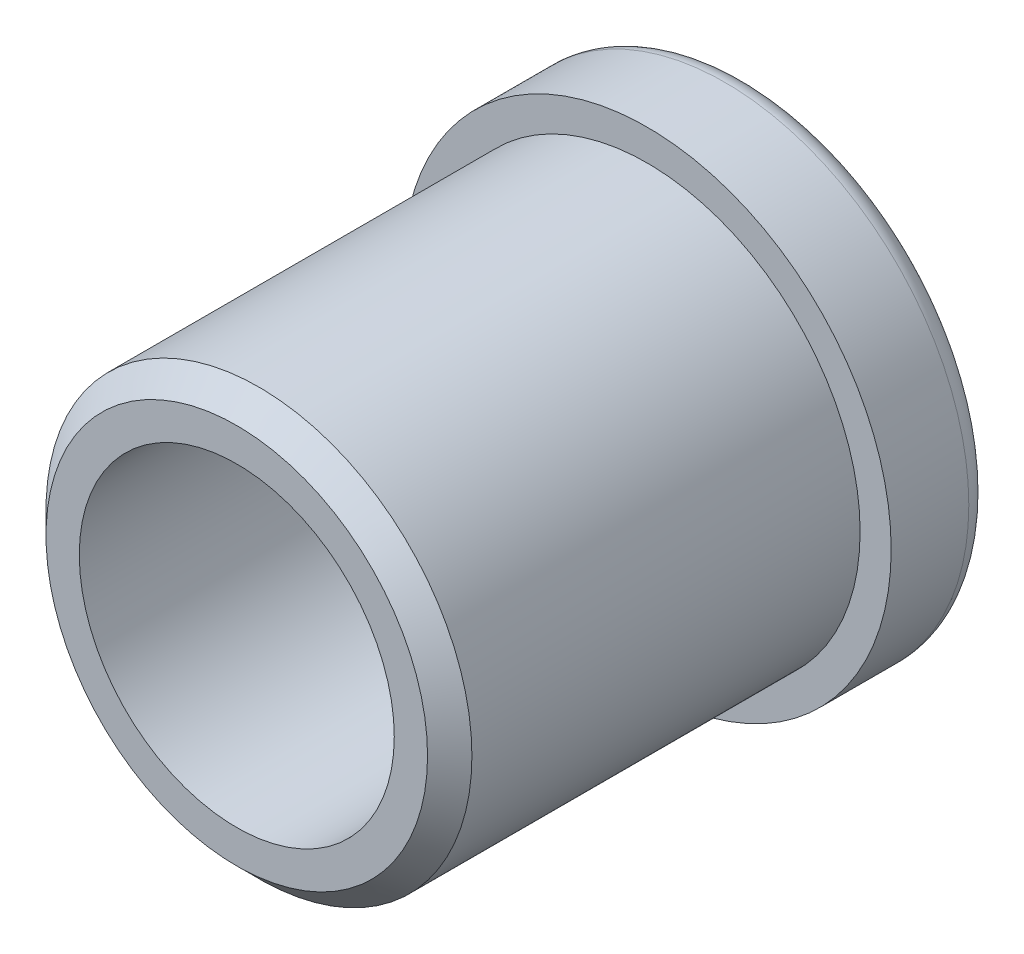
from build123d import *

# Parameters (mm, degrees)
SKETCH_1_R          = 11
SKETCH_1_R_2        = 6.6
EXTRUDE_1_DEPTH     = 3
SKETCH_2_R          = 9.6
SKETCH_2_R_2        = 7.1
EXTRUDE_2_DEPTH     = 20
CHAMFER_1_SIZE      = 1
FILLET_1_R          = 1
SKETCH_3_R          = 11
SKETCH_3_R_2        = 9.6
EXTRUDE_3_DEPTH     = 1.5
SKETCH_4_R          = 7.1
SKETCH_4_R_2        = 6.6
EXTRUDE_4_DEPTH     = 8.5
SKETCH_5_R          = 7.5
CUT_EXTRUDE_1_DEPTH = 10
CHAMFER_2_SIZE      = 1


with BuildPart() as part:
    # 스케치1 → 보스-돌출1 (new body)
    with BuildSketch(Plane.XY):
        Circle(SKETCH_1_R)
        Circle(SKETCH_1_R_2, mode=Mode.SUBTRACT)
    extrude(amount=EXTRUDE_1_DEPTH)

    # 스케치2 → 보스-돌출2 (add)
    with BuildSketch(Plane.XY.offset(3)):
        Circle(SKETCH_2_R)
        Circle(SKETCH_2_R_2, mode=Mode.SUBTRACT)
    extrude(amount=EXTRUDE_2_DEPTH)

    # 모따기1
    chamfer_1_edges = [part.edges().sort_by_distance(p)[0] for p in [
        (-9.6, 0, 23),
    ]]
    chamfer(chamfer_1_edges, length=CHAMFER_1_SIZE)

    # 필렛1
    fillet_1_edges = [part.edges().sort_by_distance(p)[0] for p in [
        (-11, 0, 0),
    ]]
    fillet(fillet_1_edges, radius=FILLET_1_R)

    # 스케치3 → 보스-돌출3 (add)
    with BuildSketch(Plane.XY.offset(3)):
        Circle(SKETCH_3_R)
        Circle(SKETCH_3_R_2, mode=Mode.SUBTRACT)
    extrude(amount=EXTRUDE_3_DEPTH)

    # 스케치4 → 보스-돌출4 (add)
    with BuildSketch(Plane.XY.offset(3)):
        Circle(SKETCH_4_R)
        Circle(SKETCH_4_R_2, mode=Mode.SUBTRACT)
    extrude(amount=EXTRUDE_4_DEPTH)

    # 스케치5 → 컷-돌출1 (cut)
    with BuildSketch(Plane(origin=(0, 0, 0), x_dir=(-1, 0, 0), z_dir=(0, 0, -1))):
        Circle(SKETCH_5_R)
    extrude(amount=-CUT_EXTRUDE_1_DEPTH, mode=Mode.SUBTRACT)

    # 모따기2
    # the kernel refuses this chamfer: 1 mm, written as the material it adds along each edge
    with BuildSketch(Plane(origin=(0, 0, 10), x_dir=(-1, 0, 0), z_dir=(0, -1, 0))) as chamfer_2_piece_1_section:
        Polygon((7.5, CHAMFER_2_SIZE), (7.5 - CHAMFER_2_SIZE, 0), (7.5, 0), align=None)
    chamfer_2_piece_1 = revolve(axis=Axis((0, 0, 10), (0, 0, -1)), mode=Mode.PRIVATE)
    chamfer_2_piece_1 = chamfer_2_piece_1 - Plane(origin=(0, 0, 9.456358799), x_dir=(1, 0, 0), z_dir=(0, 0, -1)) * Cylinder(6.6, 30, mode=Mode.PRIVATE)
    add(chamfer_2_piece_1)
    # the kernel refuses this chamfer: 1 mm, written as the material it takes off along each edge
    with BuildSketch(Plane(origin=(0, 0, 0), x_dir=(-1, 0, 0), z_dir=(0, -1, 0))) as chamfer_2_2_piece_1:
        Polygon((7.5, -CHAMFER_2_SIZE), (7.5 + CHAMFER_2_SIZE, 0), (7.5, 0), align=None)
    revolve(axis=Axis((0, 0, 0), (0, 0, -1)), mode=Mode.SUBTRACT)


solid = part.part
